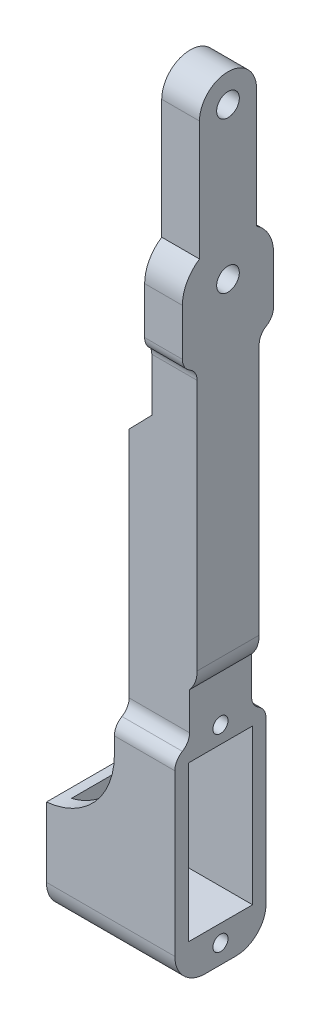
from build123d import *

# Parameters (mm, degrees)
SKETCH1_R               = 10
SKETCH1_R_2             = 0.8
SKETCH1_R_3             = 3.301767793
BOSS_EXTRUDE1_DEPTH     = 1.5
SKETCH2_R               = 10
BOSS_EXTRUDE2_DEPTH     = 9
CUT_EXTRUDE1_DEPTH      = 93.583714931
CUT_EXTRUDE1_DEPTH_BACK = 93.583714931
SKETCH3_R               = 1.5
FILLET1_R               = 5
SKETCH4_R               = 1.5
BOSS_EXTRUDE3_DEPTH     = 5
CUT_EXTRUDE2_DEPTH      = 4
FILLET3_R               = 2
SKETCH6_W               = 12.069016708
SKETCH6_H               = 36.150412664
BOSS_EXTRUDE4_DEPTH     = 9
CUT_EXTRUDE3_DEPTH      = 112.059195252
CUT_EXTRUDE3_DEPTH_BACK = 112.059195252
CUT_EXTRUDE4_DEPTH      = 111.336877259
CUT_EXTRUDE4_DEPTH_BACK = 111.336877259
SKETCH8_R               = 1
SKETCH8_W               = 8.5
SKETCH8_H               = 20.5
FILLET4_R               = 4
SKETCH9_W               = 24.382356312
SKETCH9_H               = 41.210730196
CUT_EXTRUDE5_DEPTH      = 1
FILLET5_R               = 4
SKETCH10_R              = 20.065343601
CUT_EXTRUDE6_DEPTH      = 3
CUT_EXTRUDE7_DEPTH      = 111.33687725
CUT_EXTRUDE7_DEPTH_BACK = 111.33687725
FILLET6_R               = 2
CHAMFER1_SIZE           = 3
BOSS_EXTRUDE5_START     = 9
SKETCH12_R              = 1
BOSS_EXTRUDE5_DEPTH     = 9
SKETCH14_W              = 8.5
SKETCH14_H              = 8.421957495
CUT_EXTRUDE8_DEPTH      = 7.5
FILLET7_R               = 10


# Some blends are built 0.0001 mm under size
with BuildPart() as part:
    # Sketch1 → Boss-Extrude1 (new body)
    with BuildSketch(Plane(origin=(0, 0, 0), x_dir=(0, 0, -1), z_dir=(1, 0, 0))):
        with Locations((2.983378847, 10.826778074)):
            Circle(SKETCH1_R)
        with Locations((2.983378847, 18.576778074)):
            Circle(SKETCH1_R_2, mode=Mode.SUBTRACT)
        with Locations((2.983378847, 3.076778074)):
            Circle(SKETCH1_R_2, mode=Mode.SUBTRACT)
        with Locations((-3.266621153, 10.826778074)):
            Circle(SKETCH1_R_2, mode=Mode.SUBTRACT)
        with Locations((9.233378847, 10.826778074)):
            Circle(SKETCH1_R_2, mode=Mode.SUBTRACT)
        with Locations((2.983378847, 10.826778074)):
            Circle(SKETCH1_R_3, mode=Mode.SUBTRACT)
    extrude(amount=BOSS_EXTRUDE1_DEPTH)

    # Sketch2 → Boss-Extrude2 (add)
    with BuildSketch(Plane.ZY):
        with BuildLine():
            Line((-15.531923741, 90.826778074), (9.565166047, 90.826778074))
            Line((9.565166047, 90.826778074), (9.565166047, 10.826778074))
            ThreePointArc((9.565166047, 10.826778074), (-2.983378847, -1.721766821), (-15.531923741, 10.826778074))
            Line((-15.531923741, 10.826778074), (-15.531923741, 90.826778074))
        make_face()
        with Locations((-2.983378847, 10.826778074)):
            Circle(SKETCH2_R, mode=Mode.SUBTRACT)
    extrude(amount=-BOSS_EXTRUDE2_DEPTH)

    # Sketch3 → Cut-Extrude1 (cut, two sides: drawn at the far end of the back side and taken through both)
    with BuildSketch(Plane(origin=(9, 0, 0), x_dir=(0, 0, -1), z_dir=(1, 0, 0)).offset(-CUT_EXTRUDE1_DEPTH_BACK)):
        with Locations((2.983378847, 85.826778074)):
            Circle(SKETCH3_R)
        with BuildLine():
            Line((-3.051129507, 36.150412664), (-3.051129507, 97.572569437))
            Line((-3.051129507, 97.572569437), (-16.389018159, 97.572569437))
            Line((-16.389018159, 97.572569437), (-16.389018159, 8.14109285))
            Line((-16.389018159, 8.14109285), (-9.565166047, 10.826778074))
            add(Edge.make_bspline(
                [(-9.565166047, 10.826778074), (-9.644230884, 15.122204253), (-6.916245701, 23.507010268), (-3.42826878, 31.561714956), (-3.051129507, 36.150412664)],
                knots=[0, 0, 0, 0, 0.482384809, 1, 1, 1, 1], degree=3))
        make_face()
        with BuildLine():
            Line((22.355775853, 8.14109285), (15.531923741, 10.826778074))
            add(Edge.make_bspline(
                [(15.531923741, 10.826778074), (15.610988578, 15.122204253), (12.883003395, 23.507010268), (9.395026474, 31.561714956), (9.017887201, 36.150412664)],
                knots=[0, 0, 0, 0, 0.482384809, 1, 1, 1, 1], degree=3))
            Line((9.017887201, 36.150412664), (9.017887201, 97.572569437))
            Line((9.017887201, 97.572569437), (22.355775853, 97.572569437))
            Line((22.355775853, 97.572569437), (22.355775853, 8.14109285))
        make_face()
    extrude(amount=CUT_EXTRUDE1_DEPTH + CUT_EXTRUDE1_DEPTH_BACK, mode=Mode.SUBTRACT)

    # Fillet1
    fillet1_edges = [part.edges().sort_by_distance(p)[0] for p in [
        (4.5, 90.826778074, 3.051129507),
        (4.5, 90.826778074, -9.017887201),
    ]]
    fillet(fillet1_edges, radius=FILLET1_R)

    # Sketch4 → Boss-Extrude3 (add)
    with BuildSketch(Plane(origin=(9, 0, 0), x_dir=(0, 0, -1), z_dir=(1, 0, 0))):
        with BuildLine():
            Line((-0.788675957, 85.826778074), (-0.788675957, 105.826778074))
            ThreePointArc((-0.788675957, 105.826778074), (2.983378847, 109.598832877), (6.755433651, 105.826778074))
            Line((6.755433651, 105.826778074), (6.755433651, 85.826778074))
            ThreePointArc((6.755433651, 85.826778074), (2.983378847, 82.05472327), (-0.788675957, 85.826778074))
        make_face()
        with Locations((2.983378847, 105.826778074)):
            Circle(SKETCH4_R, mode=Mode.SUBTRACT)
        with Locations((2.983378847, 85.826778074)):
            Circle(SKETCH4_R, mode=Mode.SUBTRACT)
    extrude(amount=-BOSS_EXTRUDE3_DEPTH)

    # Sketch5 → Cut-Extrude2 (cut)
    with BuildSketch(Plane.ZY):
        Polygon((3.051129507, 66.690354093), (-0.520583075, 90.618436978), (8.994411849, 90.618436978), (4.452818785, 66.690354093), align=None)
        Polygon((-9.017887201, 66.690354093), (-5.446174619, 90.618436978), (-12.469802715, 95.280611626), (-31.447569196, 66.690354093), align=None)
    extrude(amount=-CUT_EXTRUDE2_DEPTH, mode=Mode.SUBTRACT)

    # Fillet3
    fillet3_edges = [part.edges().sort_by_distance(p)[0] for p in [
        (2, 90.618436978, -5.446174619),
        (2, 90.618436978, -0.520583075),
    ]]
    fillet(fillet3_edges, radius=FILLET3_R)

    # Sketch6 → Boss-Extrude4 (add)
    with BuildSketch(Plane(origin=(9, 0, 0), x_dir=(0, 0, -1), z_dir=(1, 0, 0))):
        with Locations((2.983378847, 18.075206332)):
            Rectangle(SKETCH6_W, SKETCH6_H)
    extrude(amount=-BOSS_EXTRUDE4_DEPTH)

    # Sketch7 → Cut-Extrude3 (cut, two sides: drawn at the far end of the back side and taken through both)
    with BuildSketch(Plane(origin=(9, 0, 0), x_dir=(0, 0, -1), z_dir=(1, 0, 0)).offset(-CUT_EXTRUDE3_DEPTH_BACK)):
        Polygon((-3.051129507, -1.9847985), (-23.499593466, -1.9847985), (-3.051129507, 36.150412664), (-3.051129507, 6.693164213), (9.017887201, 6.693164213), (9.017887201, 36.150412664), (33.091996179, 2.744303699), (9.017887201, -7.659721138), align=None)
    extrude(amount=CUT_EXTRUDE3_DEPTH + CUT_EXTRUDE3_DEPTH_BACK, mode=Mode.SUBTRACT)

    # Sketch8 → Cut-Extrude4 (cut, two sides: drawn at the far end of the back side and taken through both)
    with BuildSketch(Plane(origin=(9, 0, 0), x_dir=(0, 0, -1), z_dir=(1, 0, 0)).offset(-CUT_EXTRUDE4_DEPTH_BACK)):
        with Locations((2.983378847, 34.223894069)):
            Circle(SKETCH8_R)
        with Locations((2.983378847, 9.223894069)):
            Circle(SKETCH8_R)
        with Locations((2.983378847, 21.723894069)):
            Rectangle(SKETCH8_W, SKETCH8_H)
    extrude(amount=CUT_EXTRUDE4_DEPTH + CUT_EXTRUDE4_DEPTH_BACK, mode=Mode.SUBTRACT)

    # Fillet4
    fillet4_edges = [part.edges().sort_by_distance(p)[0] for p in [
        (4.5, 6.693164213, -9.017887201),
        (4.5, 6.693164213, 3.051129507),
    ]]
    fillet(fillet4_edges, radius=FILLET4_R)

    # Sketch9 → Cut-Extrude5 (cut)
    with BuildSketch(Plane(origin=(9, 0, 0), x_dir=(0, 0, -1), z_dir=(1, 0, 0))):
        with Locations((3.21232116, 19.691143361)):
            Rectangle(SKETCH9_W, SKETCH9_H)
    extrude(amount=-CUT_EXTRUDE5_DEPTH, mode=Mode.SUBTRACT)

    # Fillet5
    # the kernel refuses this fillet: 4 mm, written as the material it takes off along each edge
    with BuildSketch(Plane(origin=(9, 40.296508459, -15.632265479), x_dir=(0, 1, 0), z_dir=(0, 0, 1))) as fillet5_piece_1:
        with BuildLine():
            CenterArc((2.645751311, 4), FILLET5_R, 228.590377891, 41.409622109)
            Line((0, 1), (-0.052915026, 0.94))
            ThreePointArc((-0.052915026, 0.94), (-0.08, 0.5), (-0.08, 0))
            Line((-0.08, 0), (0, -0.08))
            Line((0, -0.08), (2.645751311, -0.08))
            Line((2.645751311, -0.08), (2.645751311, 0))
        make_face()
    extrude(amount=25.297773264, mode=Mode.SUBTRACT)

    # Sketch10 → Cut-Extrude6 (cut)
    with BuildSketch(Plane.ZY):
        with Locations((-2.983378847, 85.826778074)):
            Circle(SKETCH10_R)
    extrude(amount=-CUT_EXTRUDE6_DEPTH, mode=Mode.SUBTRACT)

    # Sketch11 → Cut-Extrude7 (cut, two sides: drawn at the far end of the back side and taken through both)
    with BuildSketch(Plane.ZY.offset(-CUT_EXTRUDE7_DEPTH_BACK)):
        with BuildLine():
            Line((-7.109989343, 76.258566083), (-7.109989343, 35.357320381))
            ThreePointArc((-7.109989343, 35.357320381), (-9.017887201, 33.449422522), (-10.925785059, 35.357320381))
            Line((-10.925785059, 35.357320381), (-10.925785059, 76.258566083))
            ThreePointArc((-10.925785059, 76.258566083), (-9.017887201, 78.166463942), (-7.109989343, 76.258566083))
        make_face()
        with BuildLine():
            Line((1.103749815, 76.258566083), (1.103749815, 35.357320381))
            ThreePointArc((1.103749815, 35.357320381), (3.011647673, 33.449422522), (4.919545531, 35.357320381))
            Line((4.919545531, 35.357320381), (4.919545531, 76.258566083))
            ThreePointArc((4.919545531, 76.258566083), (3.011647673, 78.166463942), (1.103749815, 76.258566083))
        make_face()
    extrude(amount=CUT_EXTRUDE7_DEPTH + CUT_EXTRUDE7_DEPTH_BACK, mode=Mode.SUBTRACT)

    # Fillet6
    fillet6_edges = [part.edges().sort_by_distance(p)[0] for p in [
        (4, 33.449422522, -9.017887201),
        (4, 33.449831083, 3.051129507),
        (6.5, 78.166463942, -9.017887201),
        (6.5, 78.166055381, 3.051129507),
    ]]
    fillet(fillet6_edges, radius=FILLET6_R)

    # Chamfer1
    chamfer1_edges = [part.edges().sort_by_distance(p)[0] for p in [
        (3, 65.761444608, -3.003546718),
    ]]
    chamfer(chamfer1_edges, length=CHAMFER1_SIZE - 0.0001)  # a hair under: the kernel refuses the full size

    # Sketch12 → Boss-Extrude5 (add)
    with BuildSketch(Plane.ZY.offset(BOSS_EXTRUDE5_START)):
        with BuildLine():
            Line((-5.017887201, 6.693164213), (-0.948870493, 6.693164213))
            ThreePointArc((-0.948870493, 6.693164213), (1.879556632, 7.864737088), (3.051129507, 10.693164213))
            Line((3.051129507, 10.693164213), (3.051129507, 19.895851564))
            Line((3.051129507, 19.895851564), (-9.017887201, 19.895851564))
            Line((-9.017887201, 19.895851564), (-9.017887201, 10.693164213))
            ThreePointArc((-9.017887201, 10.693164213), (-7.846314326, 7.864737088), (-5.017887201, 6.693164213))
        make_face()
        with Locations((-2.983378847, 16.223894069)):
            Circle(SKETCH12_R, mode=Mode.SUBTRACT)
        with Locations((-2.983378847, 9.223894069)):
            Circle(SKETCH12_R, mode=Mode.SUBTRACT)
    extrude(amount=-BOSS_EXTRUDE5_DEPTH)

    # Sketch14 → Cut-Extrude8 (cut)
    with BuildSketch(Plane(origin=(0, 0, 0), x_dir=(0, 0, -1), z_dir=(1, 0, 0))):
        with Locations((2.983378847, 15.684872817)):
            Rectangle(SKETCH14_W, SKETCH14_H)
    extrude(amount=-CUT_EXTRUDE8_DEPTH, mode=Mode.SUBTRACT)

    # Fillet7
    # the kernel refuses this fillet: 10 mm, written as the material it adds along each edge
    with BuildSketch(Plane(origin=(0, 19.895851564, 3.051129507), x_dir=(-1, 0, 0), z_dir=(0, 0, -1))) as fillet7_piece_1_section:
        with BuildLine():
            CenterArc((10, 9.949874371), FILLET7_R, 180, 84.260829523)
            Line((0, 9.949874371), (-0.2, 9.949874371))
            Line((-0.2, 9.949874371), (-0.2, 0))
            Line((-0.2, 0), (0, -0.2))
            ThreePointArc((0, -0.2), (4.5, -0.2), (8.98, -0.198997487))
            Line((8.98, -0.198997487), (9, 0))
        make_face()
    fillet7_piece_1 = extrude(amount=1.784508354, mode=Mode.PRIVATE)
    fillet7_piece_1 = split(fillet7_piece_1, bisect_by=Plane(origin=(-7.5, 19.86328745, 2.15887533), z_dir=(-1, 0, 0)), keep=Keep.TOP, mode=Mode.PRIVATE)
    add(fillet7_piece_1)
    with BuildSketch(Plane(origin=(0, 19.895851564, 3.051129507), x_dir=(-1, 0, 0), z_dir=(0, 0, -1))) as fillet7_piece_2_section:
        with BuildLine():
            CenterArc((10, 9.949874371), FILLET7_R, 180, 84.260829523)
            Line((0, 9.949874371), (-0.2, 9.949874371))
            Line((-0.2, 9.949874371), (-0.2, 0))
            Line((-0.2, 0), (0, -0.2))
            ThreePointArc((0, -0.2), (4.5, -0.2), (8.98, -0.198997487))
            Line((8.98, -0.198997487), (9, 0))
        make_face()
    fillet7_piece_2 = extrude(amount=1.784508354, mode=Mode.PRIVATE)
    fillet7_piece_2 = split(fillet7_piece_2, bisect_by=Plane(origin=(-7.5, 22.222346104, 2.15887533), z_dir=(1, 0, 0)), keep=Keep.TOP, mode=Mode.PRIVATE)
    add(fillet7_piece_2)
    with BuildSketch(Plane(origin=(0, 19.895851564, 3.051129507), x_dir=(-1, 0, 0), z_dir=(0, 0, -1))) as fillet7_piece_3_section:
        with BuildLine():
            CenterArc((10, 9.949874371), FILLET7_R, 180, 84.260829523)
            Line((0, 9.949874371), (-0.2, 9.949874371))
            Line((-0.2, 9.949874371), (-0.2, 0))
            Line((-0.2, 0), (0, -0.2))
            ThreePointArc((0, -0.2), (4.5, -0.2), (8.98, -0.198997487))
            Line((8.98, -0.198997487), (9, 0))
        make_face()
    fillet7_piece_3 = extrude(amount=26.659194282, mode=Mode.PRIVATE)
    fillet7_piece_3 = split(fillet7_piece_3, bisect_by=Plane(origin=(-7.5, 19.86328745, -2.983378847), z_dir=(-1, 0, 0)), keep=Keep.TOP, mode=Mode.PRIVATE)
    fillet7_piece_3 = split(fillet7_piece_3, bisect_by=Plane(origin=(-8.13962248, 19.86328745, 1.266621153), z_dir=(0, 0, -1)), keep=Keep.TOP, mode=Mode.PRIVATE)
    fillet7_piece_3 = split(fillet7_piece_3, bisect_by=Plane(origin=(-8.13962248, 19.86328745, -7.233378847), z_dir=(0, 0, 1)), keep=Keep.TOP, mode=Mode.PRIVATE)
    add(fillet7_piece_3)
    with BuildSketch(Plane(origin=(0, 19.895851564, 3.051129507), x_dir=(-1, 0, 0), z_dir=(0, 0, -1))) as fillet7_piece_4_section:
        with BuildLine():
            CenterArc((10, 9.949874371), FILLET7_R, 180, 84.260829523)
            Line((0, 9.949874371), (-0.2, 9.949874371))
            Line((-0.2, 9.949874371), (-0.2, 0))
            Line((-0.2, 0), (0, -0.2))
            ThreePointArc((0, -0.2), (4.5, -0.2), (8.98, -0.198997487))
            Line((8.98, -0.198997487), (9, 0))
        make_face()
    fillet7_piece_4 = extrude(amount=26.659194282, mode=Mode.PRIVATE)
    fillet7_piece_4 = split(fillet7_piece_4, bisect_by=Plane(origin=(-8.13962248, 19.86328745, -9.017887201), z_dir=(0, 0, 1)), keep=Keep.TOP, mode=Mode.PRIVATE)
    fillet7_piece_4 = split(fillet7_piece_4, bisect_by=Plane(origin=(-7.5, 19.86328745, -8.125633024), z_dir=(-1, 0, 0)), keep=Keep.TOP, mode=Mode.PRIVATE)
    fillet7_piece_4 = split(fillet7_piece_4, bisect_by=Plane(origin=(-8.13962248, 19.86328745, -7.233378847), z_dir=(0, 0, -1)), keep=Keep.TOP, mode=Mode.PRIVATE)
    add(fillet7_piece_4)
    with BuildSketch(Plane(origin=(0, 19.895851564, 3.051129507), x_dir=(-1, 0, 0), z_dir=(0, 0, -1))) as fillet7_piece_5_section:
        with BuildLine():
            CenterArc((10, 9.949874371), FILLET7_R, 180, 84.260829523)
            Line((0, 9.949874371), (-0.2, 9.949874371))
            Line((-0.2, 9.949874371), (-0.2, 0))
            Line((-0.2, 0), (0, -0.2))
            ThreePointArc((0, -0.2), (4.5, -0.2), (8.98, -0.198997487))
            Line((8.98, -0.198997487), (9, 0))
        make_face()
    fillet7_piece_5 = extrude(amount=26.659194282, mode=Mode.PRIVATE)
    fillet7_piece_5 = split(fillet7_piece_5, bisect_by=Plane(origin=(-2.047205635, 22.222346104, -9.017887201), z_dir=(0, 0, 1)), keep=Keep.TOP, mode=Mode.PRIVATE)
    fillet7_piece_5 = split(fillet7_piece_5, bisect_by=Plane(origin=(-7.5, 22.222346104, -8.125633024), z_dir=(1, 0, 0)), keep=Keep.TOP, mode=Mode.PRIVATE)
    fillet7_piece_5 = split(fillet7_piece_5, bisect_by=Plane(origin=(-2.047205635, 22.222346104, -7.233378847), z_dir=(0, 0, -1)), keep=Keep.TOP, mode=Mode.PRIVATE)
    add(fillet7_piece_5)


solid = part.part
